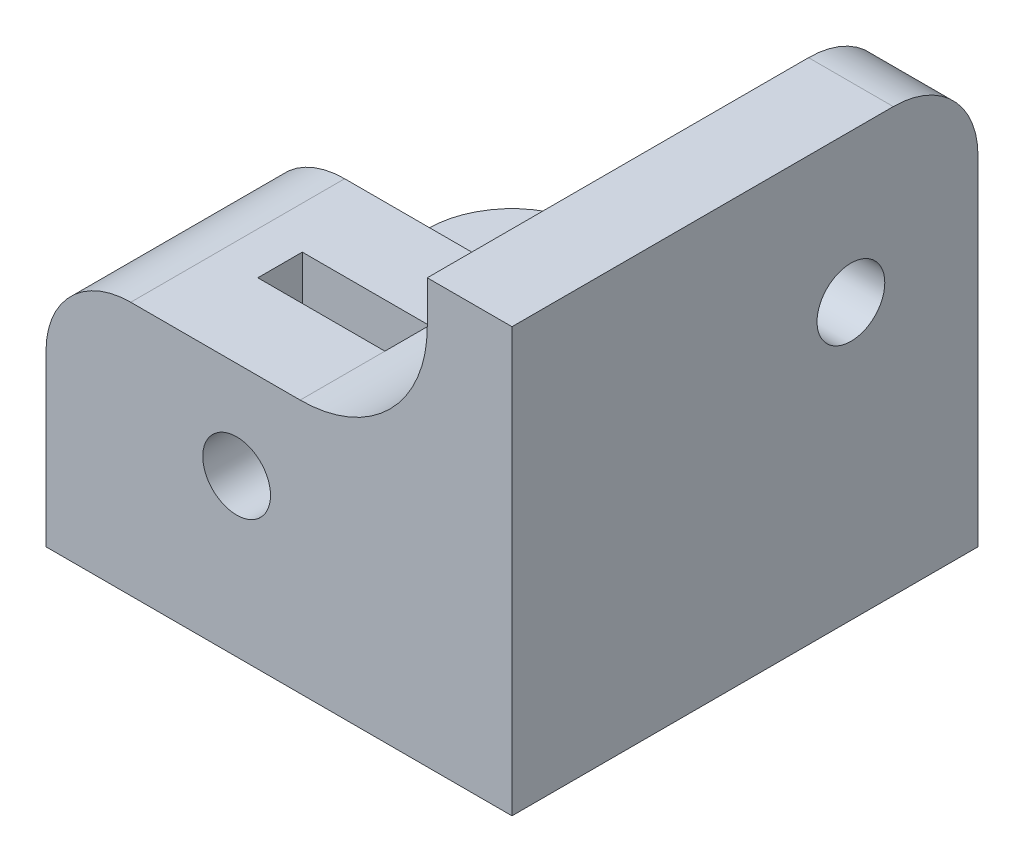
from build123d import *

# Parameters (mm, degrees)
SKETCH2_W                         = 18
SKETCH2_H                         = 22
SKETCH2_W_2                       = 4
BOSS_EXTRUDE1_DEPTH               = 4
SKETCH2_4_W                       = 18
SKETCH2_4_H                       = 10.1
SKETCH2_4_W_2                     = 6
SKETCH2_4_H_2                     = 2.1
BOSS_EXTRUDE2_DEPTH               = 12
SKETCH2_5_W                       = 4
SKETCH2_5_H                       = 22
BOSS_EXTRUDE3_DEPTH               = 20
F_3_2_3_2_MOUNT_HOLES_D           = 3.2
F_3_2_3_2_MOUNT_HOLES_ON_FACE_2_D = 3.2
F_3_2_3_2_MOUNT_HOLES_ON_FACE_3_D = 3.2
FILLET2_R                         = 6
FILLET1_R                         = 2
FILLET3_R                         = 4


with BuildPart() as part:
    # Sketch2 → Boss-Extrude1 (new body)
    with BuildSketch(Plane(origin=(0, 0, 0), x_dir=(1, 0, 0), z_dir=(0, 1, 0))):
        with Locations((0, 11)):
            Rectangle(SKETCH2_W, SKETCH2_H)
        with Locations((11, 11)):
            Rectangle(SKETCH2_W_2, SKETCH2_H)
    extrude(amount=BOSS_EXTRUDE1_DEPTH)

    # Sketch2<4> → Boss-Extrude2 (add)
    with BuildSketch(Plane(origin=(0, 0, 0), x_dir=(1, 0, 0), z_dir=(0, 1, 0))):
        with Locations((0, 5.05)):
            Rectangle(SKETCH2_4_W, SKETCH2_4_H)
        with Locations((0, 5.05)):
            Rectangle(SKETCH2_4_W_2, SKETCH2_4_H_2, mode=Mode.SUBTRACT)
    extrude(amount=BOSS_EXTRUDE2_DEPTH)

    # Sketch2<5> → Boss-Extrude3 (add)
    with BuildSketch(Plane(origin=(0, 0, 0), x_dir=(1, 0, 0), z_dir=(0, 1, 0))):
        with Locations((11, 11)):
            Rectangle(SKETCH2_5_W, SKETCH2_5_H)
    extrude(amount=BOSS_EXTRUDE3_DEPTH)

    # Ø3.2 (3.2) Mount Holes (through all)
    with Locations(Plane(origin=(0, 7.4, 0), x_dir=(1, 0, 0), z_dir=(0, 0, 1))):
        with Locations((0, 0)):
            Hole(F_3_2_3_2_MOUNT_HOLES_D / 2)

    # Ø3.2 (3.2) Mount Holes on face 2 (through all)
    with Locations(Plane(origin=(0, 0, -16), x_dir=(0, 0, -1), z_dir=(0, -1, 0))):
        with Locations((0, 0)):
            Hole(F_3_2_3_2_MOUNT_HOLES_ON_FACE_2_D / 2)

    # Ø3.2 (3.2) Mount Holes on face 3 (through all)
    with Locations(Plane(origin=(13, 13, -16), x_dir=(0, 0, 1), z_dir=(1, 0, 0))):
        with Locations((0, 0)):
            Hole(F_3_2_3_2_MOUNT_HOLES_ON_FACE_3_D / 2)

    # Fillet2
    fillet2_edges = [part.edges().sort_by_distance(p)[0] for p in [
        (9, 12, -5.05),
    ]]
    fillet(fillet2_edges, radius=FILLET2_R - 0.0001)  # a hair under: the kernel refuses the full size

    # Fillet1
    fillet1_edges = [part.edges().sort_by_distance(p)[0] for p in [
        (9, 10.99995, -10.1),
        (0, 4, -10.1),
        (9, 4, -16.05),
    ]]
    fillet(fillet1_edges, radius=FILLET1_R)

    # Fillet3
    fillet3_edges = [part.edges().sort_by_distance(p)[0] for p in [
        (-9, 12, -5.05),
        (11, 20, -22),
        (-9, 2, -22),
    ]]
    fillet(fillet3_edges, radius=FILLET3_R)


solid = part.part
